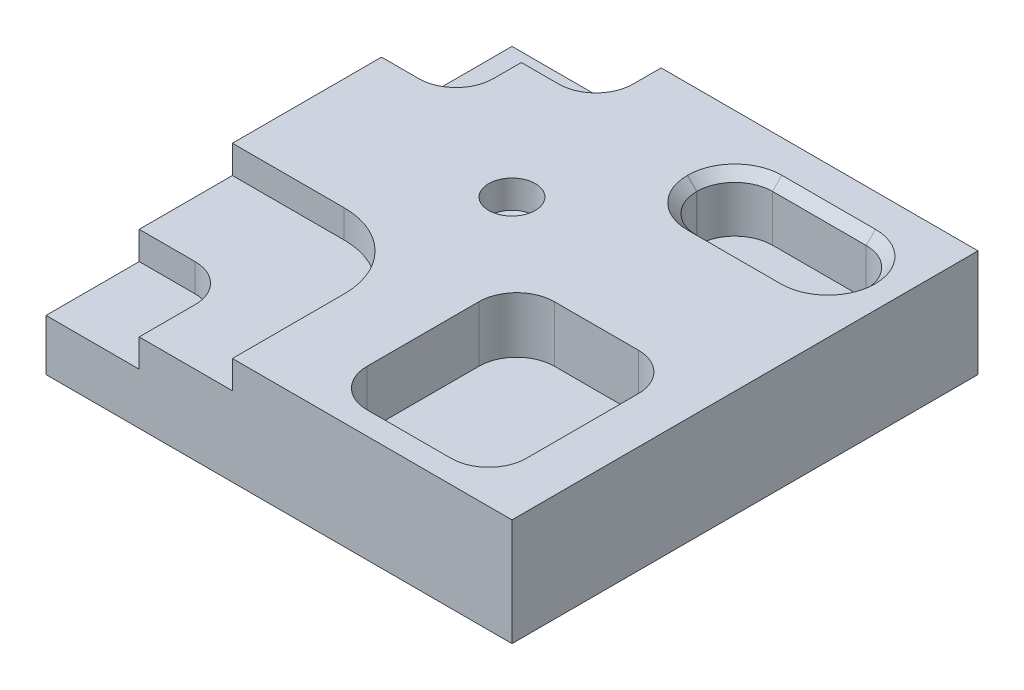
from build123d import *

# Parameters (mm, degrees)
SKETCH1_W                            = 50
SKETCH1_H                            = 50
BOSS_EXTRUDE1_DEPTH                  = 11.5
SKETCH2_W                            = 10
SKETCH2_H                            = 10
CUT_EXTRUDE1_DEPTH                   = 6
SKETCH3_W                            = 20
SKETCH3_H                            = 20
CUT_EXTRUDE2_DEPTH                   = 3
FILLET1_R                            = 8
FILLET2_R                            = 4
SKETCH4_W                            = 17.1
SKETCH4_H                            = 20.1
CUT_EXTRUDE3_DEPTH                   = 6
FILLET3_R                            = 4.05
SKETCH6_W                            = 16
SKETCH6_H                            = 7
CUT_EXTRUDE4_DEPTH                   = 6
SKETCH7_W                            = 8
SKETCH7_H                            = 7
CUT_EXTRUDE5_DEPTH                   = 6
FILLET4_R                            = 4
SKETCH9_W                            = 18.15
SKETCH9_H                            = 8.15
CUT_EXTRUDE6_DEPTH                   = 6
FILLET5_R                            = 4.05
F_97_0_11811024_DIAMETER_HOLE1_D     = 3.000000096
F_97_0_11811024_DIAMETER_HOLE1_DEPTH = 6
F_97_0_11811024_DIAMETER_HOLE1_TIP   = 0.901290957
F_97_0_19685039_DIAMETER_HOLE1_D     = 4.999999906
F_97_0_19685039_DIAMETER_HOLE1_DEPTH = 3
F_97_0_19685039_DIAMETER_HOLE1_TIP   = 1.502151519
CHAMFER1_SIZE                        = 1


with BuildPart() as part:
    # Sketch1 → Boss-Extrude1 (new body)
    with BuildSketch(Plane(origin=(0, 0, 0), x_dir=(1, 0, 0), z_dir=(0, 1, 0))):
        Rectangle(SKETCH1_W, SKETCH1_H)
    extrude(amount=BOSS_EXTRUDE1_DEPTH)

    # Sketch2 → Cut-Extrude1 (cut)
    with BuildSketch(Plane(origin=(0, 11.5, 0), x_dir=(1, 0, 0), z_dir=(0, 1, 0))):
        with Locations((-20, -20)):
            Rectangle(SKETCH2_W, SKETCH2_H)
    extrude(amount=-CUT_EXTRUDE1_DEPTH, mode=Mode.SUBTRACT)

    # Sketch3 → Cut-Extrude2 (cut)
    with BuildSketch(Plane(origin=(0, 11.5, 0), x_dir=(1, 0, 0), z_dir=(0, 1, 0))):
        with Locations((-15, -15)):
            Rectangle(SKETCH3_W, SKETCH3_H)
    extrude(amount=-CUT_EXTRUDE2_DEPTH, mode=Mode.SUBTRACT)

    # Fillet1
    fillet1_edges = [part.edges().sort_by_distance(p)[0] for p in [
        (-5, 10, 5),
    ]]
    fillet(fillet1_edges, radius=FILLET1_R)

    # Fillet2
    fillet2_edges = [part.edges().sort_by_distance(p)[0] for p in [
        (-15, 7, 15),
    ]]
    fillet(fillet2_edges, radius=FILLET2_R)

    # Sketch4 → Cut-Extrude3 (cut)
    with BuildSketch(Plane(origin=(0, 11.5, 0), x_dir=(1, 0, 0), z_dir=(0, 1, 0))):
        with Locations((11.5, -12.5)):
            Rectangle(SKETCH4_W, SKETCH4_H)
    extrude(amount=-CUT_EXTRUDE3_DEPTH, mode=Mode.SUBTRACT)

    # Fillet3
    fillet3_edges = [part.edges().sort_by_distance(p)[0] for p in [
        (2.95, 8.5, 22.55),
        (20.05, 8.5, 22.55),
        (20.05, 8.5, 2.45),
        (2.95, 8.5, 2.45),
    ]]
    fillet(fillet3_edges, radius=FILLET3_R)

    # Sketch6 → Cut-Extrude4 (cut)
    with BuildSketch(Plane(origin=(0, 11.5, 0), x_dir=(1, 0, 0), z_dir=(0, 1, 0))):
        with Locations((-17, 21.5)):
            Rectangle(SKETCH6_W, SKETCH6_H)
    extrude(amount=-CUT_EXTRUDE4_DEPTH, mode=Mode.SUBTRACT)

    # Sketch7 → Cut-Extrude5 (cut)
    with BuildSketch(Plane(origin=(0, 11.5, 0), x_dir=(1, 0, 0), z_dir=(0, 1, 0))):
        with Locations((-21, 14.5)):
            Rectangle(SKETCH7_W, SKETCH7_H)
    extrude(amount=-CUT_EXTRUDE5_DEPTH, mode=Mode.SUBTRACT)

    # Fillet4
    fillet4_edges = [part.edges().sort_by_distance(p)[0] for p in [
        (-9, 8.5, -18),
        (-17, 8.5, -11),
    ]]
    fillet(fillet4_edges, radius=FILLET4_R)

    # Sketch9 → Cut-Extrude6 (cut)
    with BuildSketch(Plane(origin=(0, 11.5, 0), x_dir=(1, 0, 0), z_dir=(0, 1, 0))):
        with Locations((12.475, 16.425)):
            Rectangle(SKETCH9_W, SKETCH9_H)
    extrude(amount=-CUT_EXTRUDE6_DEPTH, mode=Mode.SUBTRACT)

    # Fillet5
    fillet5_edges = [part.edges().sort_by_distance(p)[0] for p in [
        (21.55, 8.5, -12.35),
        (3.4, 8.5, -12.35),
        (3.4, 8.5, -20.5),
        (21.55, 8.5, -20.5),
    ]]
    fillet(fillet5_edges, radius=FILLET5_R)

    # #97 (0.11811024) Diameter Hole1
    with Locations(Plane(origin=(0, 11.5, 0), x_dir=(1, 0, 0), z_dir=(0, 1, 0))):
        with Locations((-5, 5)):
            Hole(F_97_0_11811024_DIAMETER_HOLE1_D / 2, depth=F_97_0_11811024_DIAMETER_HOLE1_DEPTH)
            with Locations((0, 0, -(F_97_0_11811024_DIAMETER_HOLE1_DEPTH + F_97_0_11811024_DIAMETER_HOLE1_TIP / 2))):  # 118° drill point
                Cone(0, F_97_0_11811024_DIAMETER_HOLE1_D / 2, F_97_0_11811024_DIAMETER_HOLE1_TIP, mode=Mode.SUBTRACT)

    # #97 (0.19685039) Diameter Hole1
    with Locations(Plane(origin=(-5, 11.5, -5), x_dir=(0, 0, 1), z_dir=(0, 1, 0))):
        with Locations((0, 0)):
            Hole(F_97_0_19685039_DIAMETER_HOLE1_D / 2, depth=F_97_0_19685039_DIAMETER_HOLE1_DEPTH)
            with Locations((0, 0, -(F_97_0_19685039_DIAMETER_HOLE1_DEPTH + F_97_0_19685039_DIAMETER_HOLE1_TIP / 2))):  # 118° drill point
                Cone(0, F_97_0_19685039_DIAMETER_HOLE1_D / 2, F_97_0_19685039_DIAMETER_HOLE1_TIP, mode=Mode.SUBTRACT)

    # Chamfer1
    chamfer1_edges = [part.edges().sort_by_distance(p)[0] for p in [
        (20.363782464, 11.5, -19.313782464),
        (12.475, 11.5, -20.5),
        (4.586217536, 11.5, -19.313782464),
        (21.55, 11.5, -16.425),
        (3.4, 11.5, -16.425),
        (20.363782464, 11.5, -13.536217536),
        (4.586217536, 11.5, -13.536217536),
        (12.475, 11.5, -12.35),
    ]]
    chamfer(chamfer1_edges, length=CHAMFER1_SIZE)


solid = part.part
